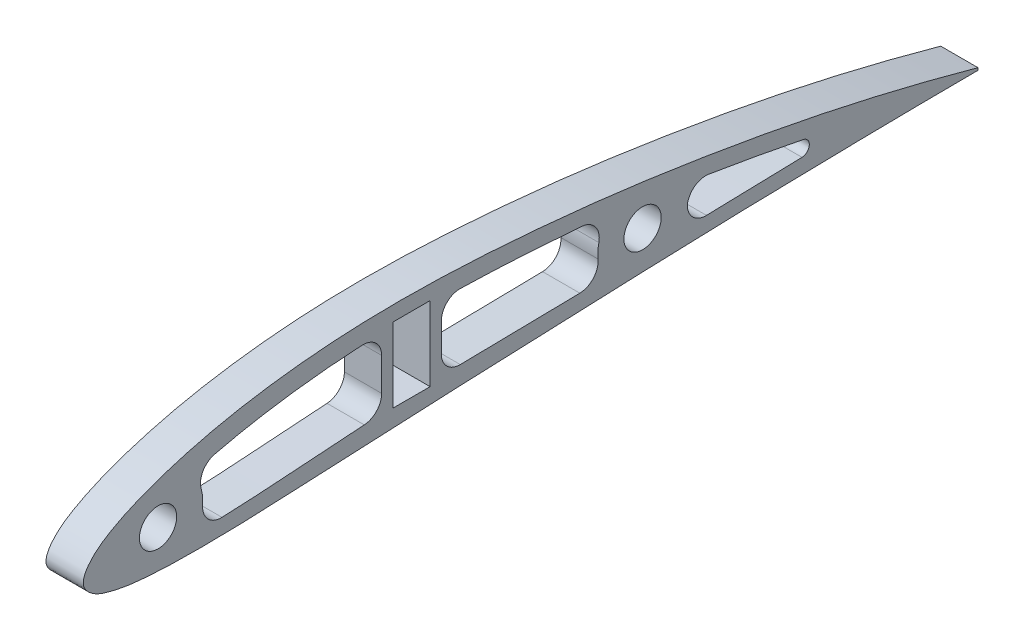
from build123d import *

# Parameters (mm, degrees)
SALIENTE_EXTRUIR1_DEPTH = 5
CROQUIS3_R              = 2.5
CORTAR_EXTRUIR1_DEPTH   = 5
CROQUIS5_W              = 5
CROQUIS5_H              = 10
CORTAR_EXTRUIR2_DEPTH   = 5
REDONDEO1_DEPTH         = 5
REDONDEO2_R             = 1


with BuildPart() as part:
    # Croquis2 → Saliente-Extruir1 (new body)
    with BuildSketch(Plane(origin=(0, 0, 0), x_dir=(0, 0, -1), z_dir=(1, 0, 0))):
        with BuildLine():
            Line((0, 0.312), (0, 0))
            add(Edge.make_bspline(
                [(0, 0.312), (-1.997937962, 0.855883829), (-5.984172101, 1.941026774), (-13.969754476, 3.914084328), (-23.956000464, 6.094072944), (-35.967556114, 8.243020219), (-47.969800137, 10.004487706), (-59.978731703, 11.260941512), (-71.986616918, 12.044579605), (-82.010943729, 12.052504921), (-90.01480163, 11.498771412), (-96.025805434, 10.769404695), (-102.049800649, 9.693800408), (-107.041673173, 8.400233687), (-111.041923446, 7.093785184), (-114.058204626, 5.860437414), (-116.631860078, 4.526604372), (-118.865795122, 2.93110484), (-120.810450078, 0.365036715), (-118.71145095, -1.597439419), (-116.569629865, -2.367784281), (-114.018868253, -2.887733145), (-111.006425112, -3.152089705), (-107.001663144, -3.339180047), (-101.998747691, -3.325166853), (-95.997395823, -3.157228981), (-90.000278469, -2.837463999), (-82.000247102, -2.463308415), (-72.001915622, -1.983166009), (-59.999653911, -1.532308544), (-48.001247876, -1.031669763), (-36.00169377, -0.605253895), (-24.001178347, -0.29159827), (-14.000300294, -0.132346287), (-6.000182393, -0.027470629), (-2.000024799, -0.009156712), (0, 0)],
                knots=[0, 0, 0, 0, 0.025304886, 0.050487653, 0.100520433, 0.150190716, 0.199586607, 0.248740009, 0.297715539, 0.346600594, 0.371102737, 0.395726297, 0.420570145, 0.445825119, 0.458702216, 0.471919982, 0.485786003, 0.493461051, 0.506863029, 0.51614777, 0.522766003, 0.535269014, 0.547551134, 0.559786371, 0.584228898, 0.60868081, 0.633151284, 0.657621757, 0.706558114, 0.75548187, 0.804405627, 0.853320224, 0.902221408, 0.951113136, 0.975557228, 1, 1, 1, 1], degree=3))
        make_face()
    extrude(amount=SALIENTE_EXTRUIR1_DEPTH)

    # Croquis3 → Cortar-Extruir1 (cut)
    with BuildSketch(Plane(origin=(5, 0, 0), x_dir=(0, 0, -1), z_dir=(1, 0, 0))):
        with Locations((-110, 1.906)):
            Circle(CROQUIS3_R)
        with Locations((-45, 4.156)):
            Circle(CROQUIS3_R)
        with BuildLine():
            Line((-72.000000017, 9.416000001), (-72.000000017, 0.495999999))
            add(Edge.make_bspline(
                [(-72.000000017, 0.495999999), (-68.01129666, 0.575920018), (-60.685821656, 0.684456619), (-53.360874788, 0.820935125), (-50.024643764, 0.876830129)],
                knots=[0.706558114, 0.706558114, 0.706558114, 0.706558114, 0.75548187, 0.796400089, 0.796400089, 0.796400089, 0.796400089], degree=3))
            ThreePointArc((-50.024643764, 0.876830129), (-50.985037611, 4.579467585), (-49.512866043, 8.109990399))
            add(Edge.make_bspline(
                [(-49.512866043, 8.109990399), (-52.983421467, 8.449081108), (-60.471100907, 9.046835898), (-67.976381823, 9.371658422), (-72.000000017, 9.416000001)],
                knots=[0.206289007, 0.206289007, 0.206289007, 0.206289007, 0.248740009, 0.297715539, 0.297715539, 0.297715539, 0.297715539], degree=3))
        make_face()
        with BuildLine():
            Line((-80, 9.491041744), (-80, 0.132962651))
            add(Edge.make_bspline(
                [(-104.942522523, -1.322300105), (-104.02844512, -1.304513093), (-101.094064778, -1.218428736), (-96.141207098, -0.982427522), (-90.090644536, -0.540517181), (-84.708866135, -0.182788773), (-81.345393913, 0.043128867), (-80, 0.132962651)],
                knots=[0.57316863, 0.57316863, 0.57316863, 0.57316863, 0.584228898, 0.60868081, 0.633151284, 0.657621757, 0.673934787, 0.673934787, 0.673934787, 0.673934787], degree=3))
            ThreePointArc((-104.942522523, -1.322300105), (-104.014074088, 2.316720069), (-105.430858936, 5.794823721))
            add(Edge.make_bspline(
                [(-80, 9.491041744), (-81.321099881, 9.446121253), (-84.626183418, 9.287675361), (-89.912800709, 8.827841386), (-95.854977781, 7.999925906), (-101.037837976, 6.979596219), (-104.212985807, 6.146867345), (-105.430858936, 5.794823721)],
                knots=[0.33030001, 0.33030001, 0.33030001, 0.33030001, 0.346600594, 0.371102737, 0.395726297, 0.420570145, 0.436202252, 0.436202252, 0.436202252, 0.436202252], degree=3))
        make_face()
        with BuildLine():
            ThreePointArc((-39.747862708, 1.255128774), (-39.007320379, 3.859704601), (-39.487323452, 6.524627721))
            add(Edge.make_bspline(
                [(-15, 1.848248895), (-18.149785119, 2.575980355), (-25.155220919, 4.084600766), (-33.337238661, 5.554150579), (-38.353786594, 6.350514551), (-39.487323452, 6.524627721)],
                knots=[0.059687027, 0.059687027, 0.059687027, 0.059687027, 0.100520433, 0.150190716, 0.164676314, 0.164676314, 0.164676314, 0.164676314], degree=3))
            add(Edge.make_bspline(
                [(-39.747862708, 1.255128774), (-38.522933592, 1.296668404), (-33.432243502, 1.462543319), (-25.183187553, 1.68029012), (-18.158050573, 1.800552691), (-15, 1.848248895)],
                knots=[0.837824168, 0.837824168, 0.837824168, 0.837824168, 0.853320224, 0.902221408, 0.942154078, 0.942154078, 0.942154078, 0.942154078], degree=3))
        make_face()
    extrude(amount=-CORTAR_EXTRUIR1_DEPTH, mode=Mode.SUBTRACT)

    # Croquis5 → Cortar-Extruir2 (cut)
    with BuildSketch(Plane(origin=(5, 0, 0), x_dir=(0, 0, -1), z_dir=(1, 0, 0))):
        with Locations((-76.000000008, 5)):
            Rectangle(CROQUIS5_W, CROQUIS5_H)
    extrude(amount=-CORTAR_EXTRUIR2_DEPTH, mode=Mode.SUBTRACT)

    # Redondeo1: read off the stored shape, not the designer's step
    # Redondeo1 outline → Redondeo1 (add)
    with BuildSketch(Plane.YZ):
        with BuildLine():
            ThreePointArc((1.363625327, 36.42666084), (2.055490703, 38.232815236), (3.828859747, 39.004847381))
            ThreePointArc((3.828859747, 39.004847381), (5.523952088, 38.02298814), (5.990815999, 36.120509834))
            add(Edge.make_bspline(
                [(5.990815999, 36.120509834), (6.174011226, 37.241939564), (6.352115292, 38.364207973), (6.524627721, 39.487323452)],
                knots=[0.150323892, 0.150323892, 0.150323892, 0.150323892, 0.164676314, 0.164676314, 0.164676314, 0.164676314], degree=3))
            ThreePointArc((6.524627721, 39.487323452), (3.859704602, 39.007320379), (1.255128774, 39.747862708))
            add(Edge.make_bspline(
                [(1.255128774, 39.747862708), (1.292669932, 38.640841355), (1.328884057, 37.53377482), (1.363625327, 36.42666084)],
                knots=[0.837824168, 0.837824168, 0.837824168, 0.837824168, 0.851828623, 0.851828623, 0.851828623, 0.851828623], degree=3))
        make_face()
        with BuildLine():
            ThreePointArc((3.507984743, 104.217816599), (5.438808007, 103.965886257), (6.603235414, 102.405227362))
            add(Edge.make_bspline(
                [(6.603235414, 102.405227362), (6.354095177, 103.418967512), (6.084783867, 104.427759758), (5.794823721, 105.430858936)],
                knots=[0.423326893, 0.423326893, 0.423326893, 0.423326893, 0.436202252, 0.436202252, 0.436202252, 0.436202252], degree=3))
            ThreePointArc((5.794823721, 105.430858936), (4.717603159, 104.699538919), (3.507984743, 104.217816599))
        make_face()
        with BuildLine():
            add(Edge.make_bspline(
                [(9.491041744, 80), (9.461187046, 80.878018844), (9.423214515, 81.755716332), (9.376506926, 82.632925827)],
                knots=[0.33030001, 0.33030001, 0.33030001, 0.33030001, 0.341133574, 0.341133574, 0.341133574, 0.341133574], degree=3))
            ThreePointArc((9.376506926, 82.632925827), (8.694197985, 80.779871308), (6.880043283, 80))
            Line((6.880043283, 80), (9.491041744, 80))
        make_face()
        with BuildLine():
            ThreePointArc((-1.217346892, 101.42745145), (-0.455395505, 103.321781492), (1.464700492, 104.016250779))
            ThreePointArc((1.464700492, 104.016250779), (0.013650887, 104.306230174), (-1.322300105, 104.942522523))
            add(Edge.make_bspline(
                [(-1.322300105, 104.942522523), (-1.304513093, 104.02844512), (-1.270137307, 102.856668551), (-1.227208305, 101.685224677), (-1.217346892, 101.42745145)],
                knots=[0.57316863, 0.57316863, 0.57316863, 0.57316863, 0.584228898, 0.587349593, 0.587349593, 0.587349593, 0.587349593], degree=3))
        make_face()
        with BuildLine():
            Line((0.132962651, 80), (2.471241745, 80))
            ThreePointArc((2.471241745, 80), (0.76358821, 80.674097646), (-0.023165141, 82.332864476))
            add(Edge.make_bspline(
                [(-0.023165141, 82.332864476), (0.028938373, 81.555247835), (0.081039245, 80.777629876), (0.132962651, 80)],
                knots=[0.66450595, 0.66450595, 0.66450595, 0.66450595, 0.673934787, 0.673934787, 0.673934787, 0.673934787], degree=3))
        make_face()
        with BuildLine():
            ThreePointArc((8.438158575, 53.096140642), (7.43338444, 51.298795363), (5.420409596, 50.865259446))
            ThreePointArc((5.420409596, 50.865259446), (6.8513973, 50.360488167), (8.109990399, 49.512866043))
            add(Edge.make_bspline(
                [(8.109990399, 49.512866043), (8.226624149, 50.706599409), (8.335976911, 51.901055686), (8.438158575, 53.096140642)],
                knots=[0.206289007, 0.206289007, 0.206289007, 0.206289007, 0.220890467, 0.220890467, 0.220890467, 0.220890467], degree=3))
        make_face()
        with BuildLine():
            ThreePointArc((0.876830129, 50.024643764), (2.163659753, 50.65955655), (3.564442647, 50.970767111))
            ThreePointArc((3.564442647, 50.970767111), (1.655977789, 51.591017802), (0.818348025, 53.414565283))
            add(Edge.make_bspline(
                [(0.818348025, 53.414565283), (0.838248228, 52.2845983), (0.857898456, 51.154627293), (0.876830129, 50.024643764)],
                knots=[0.782541063, 0.782541063, 0.782541063, 0.782541063, 0.796400089, 0.796400089, 0.796400089, 0.796400089], degree=3))
        make_face()
        with BuildLine():
            ThreePointArc((6.871491343, 72.000000017), (8.660450653, 71.246317453), (9.370764011, 69.439699686))
            add(Edge.make_bspline(
                [(9.370764011, 69.439699686), (9.391351193, 70.29297827), (9.406593246, 71.146417681), (9.416000001, 72.000000017)],
                knots=[0.287325724, 0.287325724, 0.287325724, 0.287325724, 0.297715539, 0.297715539, 0.297715539, 0.297715539], degree=3))
            Line((9.416000001, 72.000000017), (6.871491343, 72.000000017))
        make_face()
        with BuildLine():
            add(Edge.make_bspline(
                [(0.495999999, 72.000000017), (0.512999759, 71.151564312), (0.529057688, 70.303110091), (0.544453868, 69.4546428)],
                knots=[0.706558114, 0.706558114, 0.706558114, 0.706558114, 0.716964669, 0.716964669, 0.716964669, 0.716964669], degree=3))
            ThreePointArc((0.544453868, 69.4546428), (1.260311311, 71.251657369), (3.044042379, 72.000000017))
            Line((3.044042379, 72.000000017), (0.495999999, 72.000000017))
        make_face()
    extrude(amount=REDONDEO1_DEPTH)

    # Redondeo2
    redondeo2_edges = [part.edges().sort_by_distance(p)[0] for p in [
        (2.5, 1.848248895, 15),
    ]]
    fillet(redondeo2_edges, radius=REDONDEO2_R)


solid = part.part
